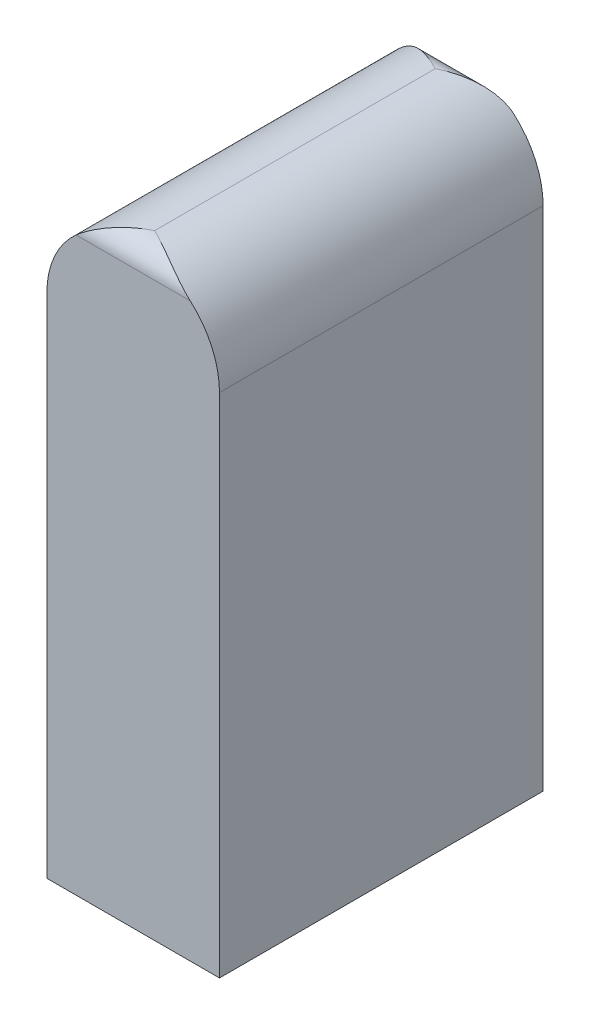
from build123d import *

# Parameters (mm, degrees)
BOSS_EXTRUDE1_DEPTH = 16
FILLET6_R           = 8
FILLET7_R           = 8


with BuildPart() as part:
    # Sketch1 → Boss-Extrude1 (new body)
    with BuildSketch(Plane.YZ):
        with BuildLine():
            Line((-27.5, -15), (25.5, -15))
            ThreePointArc((25.5, -15), (26.914213562, -14.414213562), (27.5, -13))
            Line((27.5, -13), (27.5, 13))
            ThreePointArc((27.5, 13), (26.914213562, 14.414213562), (25.5, 15))
            Line((25.5, 15), (-27.5, 15))
            Line((-27.5, 15), (-27.5, -15))
        make_face()
    extrude(amount=BOSS_EXTRUDE1_DEPTH)

    # Fillet6
    # the kernel refuses this fillet: 8 mm, written as the material it takes off along each edge
    with BuildSketch(Plane(origin=(16, 27.5, -33), x_dir=(-1, 0, 0), z_dir=(0, 0, 1))) as fillet6_piece_1:
        with BuildLine():
            CenterArc((FILLET6_R, FILLET6_R), FILLET6_R, 180, 90)
            Line((0, FILLET6_R), (0, 0))
            Line((0, 0), (FILLET6_R, 0))
        make_face()
    extrude(amount=66, mode=Mode.SUBTRACT)

    # Fillet7
    # the kernel refuses this fillet: 8 mm, written as the material it takes off along each edge
    with BuildSketch(Plane(origin=(0, 27.5, -33), x_dir=(0, -1, 0), z_dir=(0, 0, 1))) as fillet7_piece_1:
        with BuildLine():
            CenterArc((FILLET7_R, FILLET7_R), FILLET7_R, 180, 90)
            Line((0, FILLET7_R), (0, 0))
            Line((0, 0), (FILLET7_R, 0))
        make_face()
    extrude(amount=66, mode=Mode.SUBTRACT)


solid = part.part
